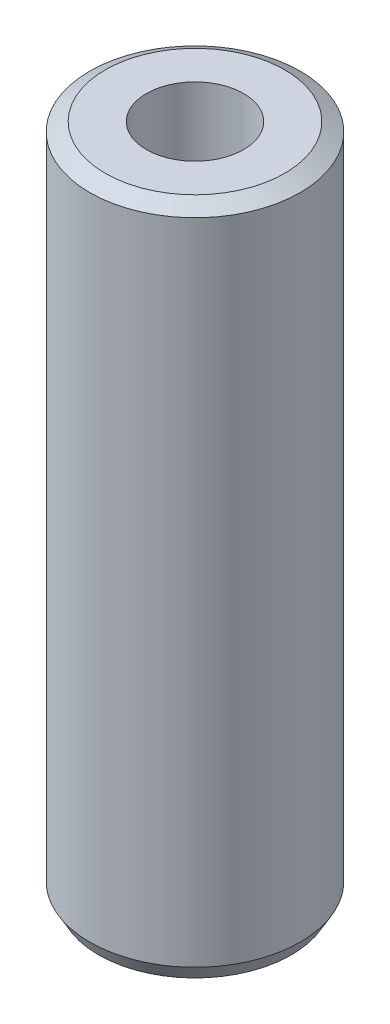
from build123d import *
from OCP.BRepFilletAPI import BRepFilletAPI_MakeChamfer

# Parameters (mm, degrees)
SKETCH1_R           = 55
BOSS_EXTRUDE1_DEPTH = 351.937780792
SKETCH2_R           = 25.401557359
CUT_EXTRUDE1_DEPTH  = 361.430577988
CHAMFER1_SIZE       = 4.639751452
CHAMFER1_SIZE2      = 8.124953888


with BuildPart() as part:
    # Sketch1 → Boss-Extrude1 (new body)
    with BuildSketch(Plane(origin=(0, 0, 0), x_dir=(1, 0, 0), z_dir=(0, 1, 0))):
        Circle(SKETCH1_R)
    extrude(amount=BOSS_EXTRUDE1_DEPTH)

    # Sketch2 → Cut-Extrude1 (cut, through all)
    with BuildSketch(Plane(origin=(0, 0, 0), x_dir=(1, 0, 0), z_dir=(0, 1, 0))):
        Circle(SKETCH2_R)
    extrude(amount=CUT_EXTRUDE1_DEPTH, mode=Mode.SUBTRACT)

    # Chamfer1: one chamfer whose edges measure the first distance from different faces: ONE call of the kernel's chamfer builder (chamfer() names one face for all edges)
    chamfer1_edges_1 = [part.edges().sort_by_distance(p)[0] for p in [
        (-55, 351.937780792, 0),
    ]]
    chamfer1_side_1 = [part.faces().sort_by_distance(p)[0] for p in [
        (-55, 175.968890396, 0),
    ]]
    chamfer1_edges_2 = [part.edges().sort_by_distance(p)[0] for p in [
        (-55, 0, 0),
    ]]
    chamfer1_side_2 = [part.faces().sort_by_distance(p)[0] for p in [
        (-53.444365081, 0, 0),
    ]]
    chamfer1 = BRepFilletAPI_MakeChamfer(part.part.solid().wrapped)
    for e in chamfer1_edges_1:
        chamfer1.Add(CHAMFER1_SIZE, CHAMFER1_SIZE2, e.wrapped, chamfer1_side_1[0].wrapped)  # the first distance lies on this face
    for e in chamfer1_edges_2:
        chamfer1.Add(CHAMFER1_SIZE, CHAMFER1_SIZE2, e.wrapped, chamfer1_side_2[0].wrapped)  # the first distance lies on this face
    add(Compound.cast(chamfer1.Shape()), mode=Mode.REPLACE)


solid = part.part
